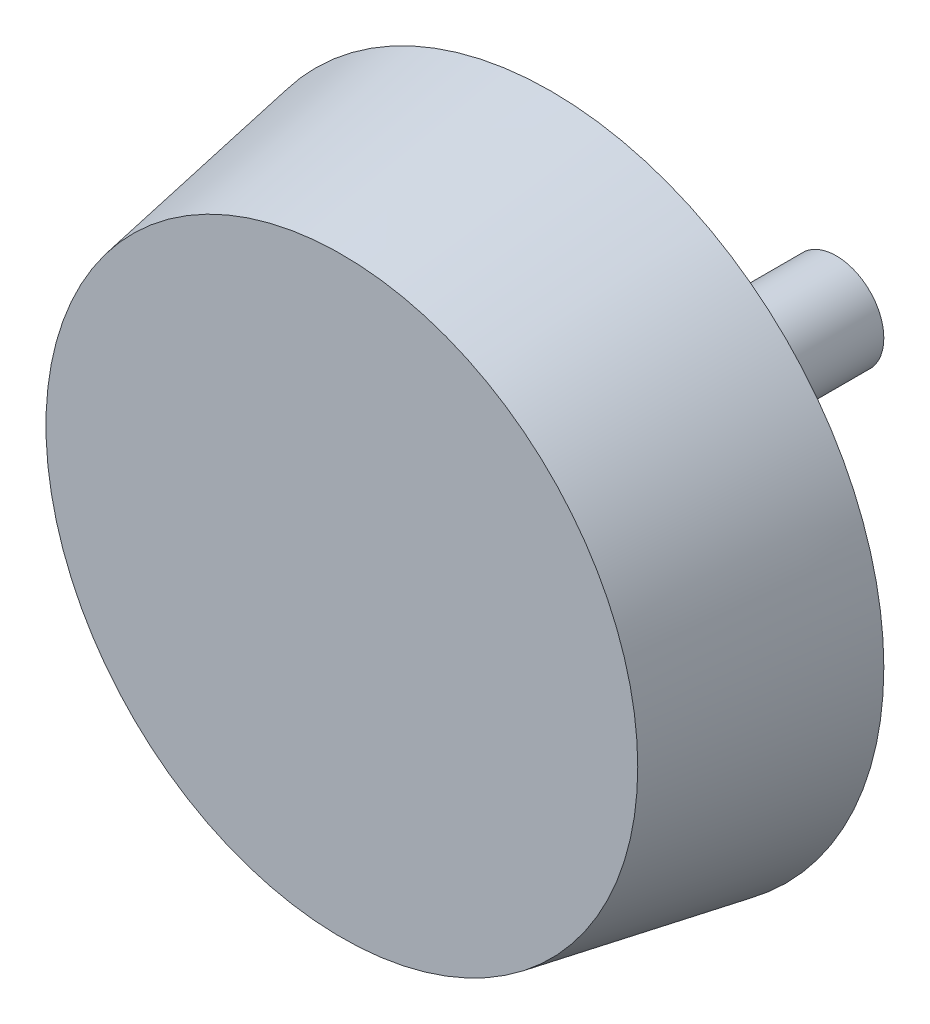
from build123d import *

# Parameters (mm, degrees)
SKETCH_2_R      = 35
EXTRUDE_1_DEPTH = 22
EXTRUDE_1_TAPER = 10
SKETCH_3_R      = 5
EXTRUDE_2_DEPTH = 30


with BuildPart() as part:
    # Эскиз2 → Бобышка-Вытянуть1 (new body)
    with BuildSketch(Plane.XY):
        Circle(SKETCH_2_R)
    extrude(amount=EXTRUDE_1_DEPTH, taper=EXTRUDE_1_TAPER)

    # Эскиз3 → Бобышка-Вытянуть2 (add)
    with BuildSketch(Plane(origin=(0, 0, 0), x_dir=(-1, 0, 0), z_dir=(0, 0, -1))):
        Circle(SKETCH_3_R)
    extrude(amount=EXTRUDE_2_DEPTH)


solid = part.part
